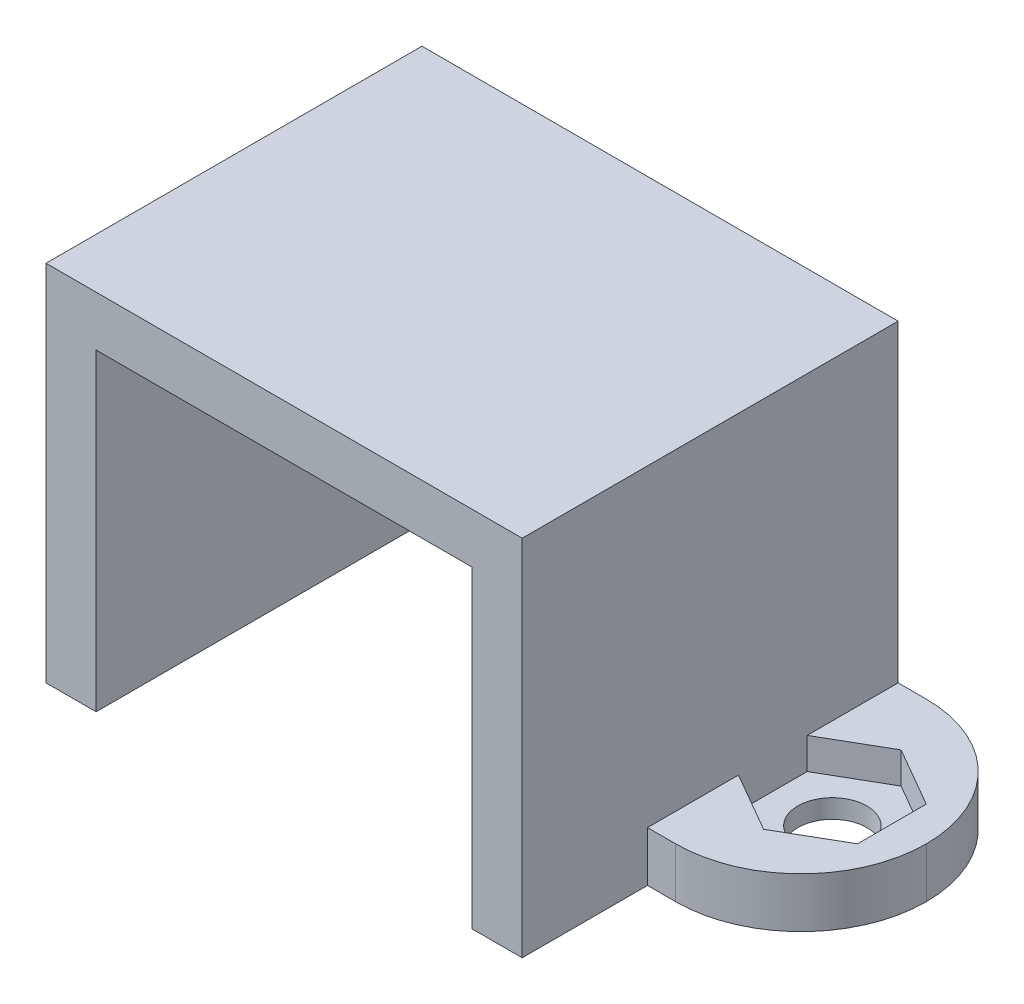
from build123d import *

# Parameters (mm, degrees)
EXTRUDE_1_DEPTH     = 12
SKETCH_2_R          = 1.1
CUT_EXTRUDE_1_DEPTH = 10
SKETCH_3_W          = 4.9
SKETCH_3_H          = 4
CUT_EXTRUDE_2_DEPTH = 1.6
FILLET_1_R          = 4
CUT_EXTRUDE_3_DEPTH = 1


with BuildPart() as part:
    # 草圖1 → 伸長-薄件1 (new body)
    with BuildSketch(Plane.XY):
        Polygon((-12.5, -10), (-6, -10), (-6, 0), (6, 0), (6, -10), (12.5, -10), (12.5, -8.4), (7.6, -8.4), (7.6, 1.6), (-7.6, 1.6), (-7.6, -8.4), (-12.5, -8.4), align=None)
    extrude(amount=EXTRUDE_1_DEPTH)

    # 草圖2 → 除料-伸長1 (cut)
    with BuildSketch(Plane(origin=(0, -8.4, 0), x_dir=(1, 0, 0), z_dir=(0, 1, 0))):
        with Locations(Location((9.5, -4, 0), (0, 0, 270))):
            Circle(SKETCH_2_R)
        with Locations(Location((-9.5, -4, 0), (0, 0, 270))):
            Circle(SKETCH_2_R)
    extrude(amount=-CUT_EXTRUDE_1_DEPTH, mode=Mode.SUBTRACT)

    # 草圖3 → 除料-伸長2 (cut)
    with BuildSketch(Plane.XZ.offset(10)):
        with Locations((-10.05, 10)):
            Rectangle(SKETCH_3_W, SKETCH_3_H)
        with Locations((10.05, 10)):
            Rectangle(SKETCH_3_W, SKETCH_3_H)
    extrude(amount=-CUT_EXTRUDE_2_DEPTH, mode=Mode.SUBTRACT)

    # 圓角1
    fillet_1_edges = [part.edges().sort_by_distance(p)[0] for p in [
        (-12.5, -9.2, 0),
        (-12.5, -9.2, 8),
        (12.5, -9.2, 0),
        (12.5, -9.2, 8),
    ]]
    fillet(fillet_1_edges, radius=FILLET_1_R - 0.0001)  # a hair under: the kernel refuses the full size

    # 草圖4 → 除料-伸長3 (cut)
    with BuildSketch(Plane(origin=(0, -8.4, 0), x_dir=(1, 0, 0), z_dir=(0, 1, 0))):
        Polygon((-7.6, -5.096965511), (-7.6, -2.903034489), (-9.5, -1.806068977), (-11.4, -2.903034489), (-11.4, -5.096965511), (-9.5, -6.193931023), align=None)
        Polygon((7.6, -5.096965511), (9.5, -6.193931023), (11.4, -5.096965511), (11.4, -2.903034489), (9.5, -1.806068977), (7.6, -2.903034489), align=None)
    extrude(amount=-CUT_EXTRUDE_3_DEPTH, mode=Mode.SUBTRACT)


solid = part.part
